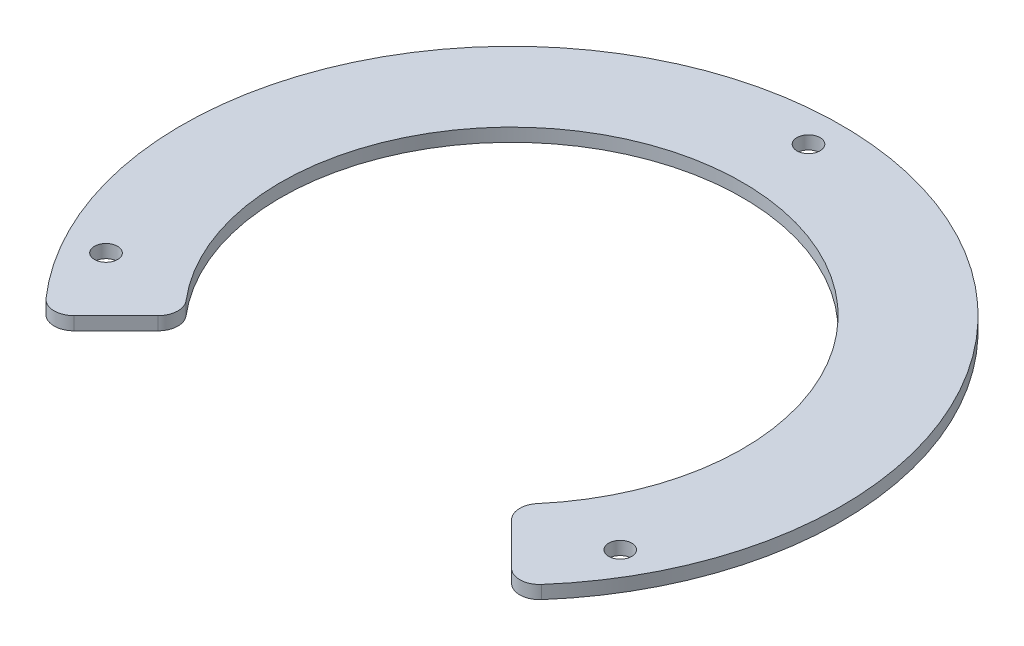
from build123d import *

# Parameters (mm, degrees)
SKETCH1_R           = 50
SKETCH1_R_2         = 35
SKETCH1_R_3         = 1.75
BOSS_EXTRUDE1_DEPTH = 2
CUT_EXTRUDE1_DEPTH  = 14
FILLET1_R           = 3


with BuildPart() as part:
    # Sketch1 → Boss-Extrude1 (new body)
    with BuildSketch(Plane(origin=(0, 0, 0), x_dir=(1, 0, 0), z_dir=(0, 1, 0))):
        Circle(SKETCH1_R)
        Circle(SKETCH1_R_2, mode=Mode.SUBTRACT)
        with Locations((0, 45)):
            Circle(SKETCH1_R_3, mode=Mode.SUBTRACT)
        with Locations((38.97114317, -22.5)):
            Circle(SKETCH1_R_3, mode=Mode.SUBTRACT)
        with Locations((-38.97114317, -22.5)):
            Circle(SKETCH1_R_3, mode=Mode.SUBTRACT)
    extrude(amount=BOSS_EXTRUDE1_DEPTH)

    # Sketch2 → Cut-Extrude1 (cut)
    with BuildSketch(Plane(origin=(0, 2, 0), x_dir=(1, 0, 0), z_dir=(0, 1, 0))):
        Polygon((0, 0), (-50, -50), (50, -50), align=None)
    extrude(amount=-CUT_EXTRUDE1_DEPTH, mode=Mode.SUBTRACT)

    # Fillet1
    fillet1_edges = [part.edges().sort_by_distance(p)[0] for p in [
        (-24.748737342, 1, 24.748737342),
        (-35.355339059, 1, 35.355339059),
        (35.355339059, 1, 35.355339059),
        (24.748737342, 1, 24.748737342),
    ]]
    fillet(fillet1_edges, radius=FILLET1_R)


solid = part.part
